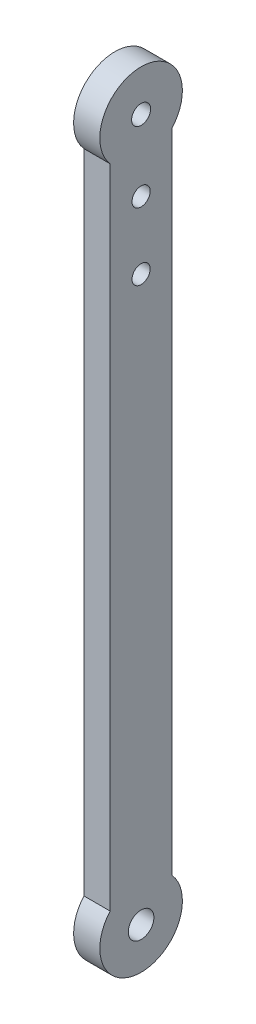
from build123d import *

# Parameters (mm, degrees)
SKETCH1_R           = 1.55
SKETCH1_R_2         = 1.1
SKETCH1_R_3         = 1.15
BOSS_EXTRUDE3_DEPTH = 3.175


with BuildPart() as part:
    # Sketch1 → Boss-Extrude3 (new body)
    with BuildSketch(Plane(origin=(0, 0, 0), x_dir=(0, 0, -1), z_dir=(1, 0, 0))):
        with BuildLine():
            Line((3.75, -3.307189139), (3.75, -81.692810861))
            ThreePointArc((3.75, -81.692810861), (0, -90), (-3.75, -81.692810861))
            Line((-3.75, -81.692810861), (-3.75, -3.307189139))
            ThreePointArc((-3.75, -3.307189139), (0, 5), (3.75, -3.307189139))
        make_face()
        with Locations((0, -85)):
            Circle(SKETCH1_R, mode=Mode.SUBTRACT)
        with Locations((0, -16.75)):
            Circle(SKETCH1_R_2, mode=Mode.SUBTRACT)
        Circle(SKETCH1_R_3, mode=Mode.SUBTRACT)
        with Locations((0, -8.6)):
            Circle(SKETCH1_R_2, mode=Mode.SUBTRACT)
    extrude(amount=BOSS_EXTRUDE3_DEPTH)


solid = part.part
